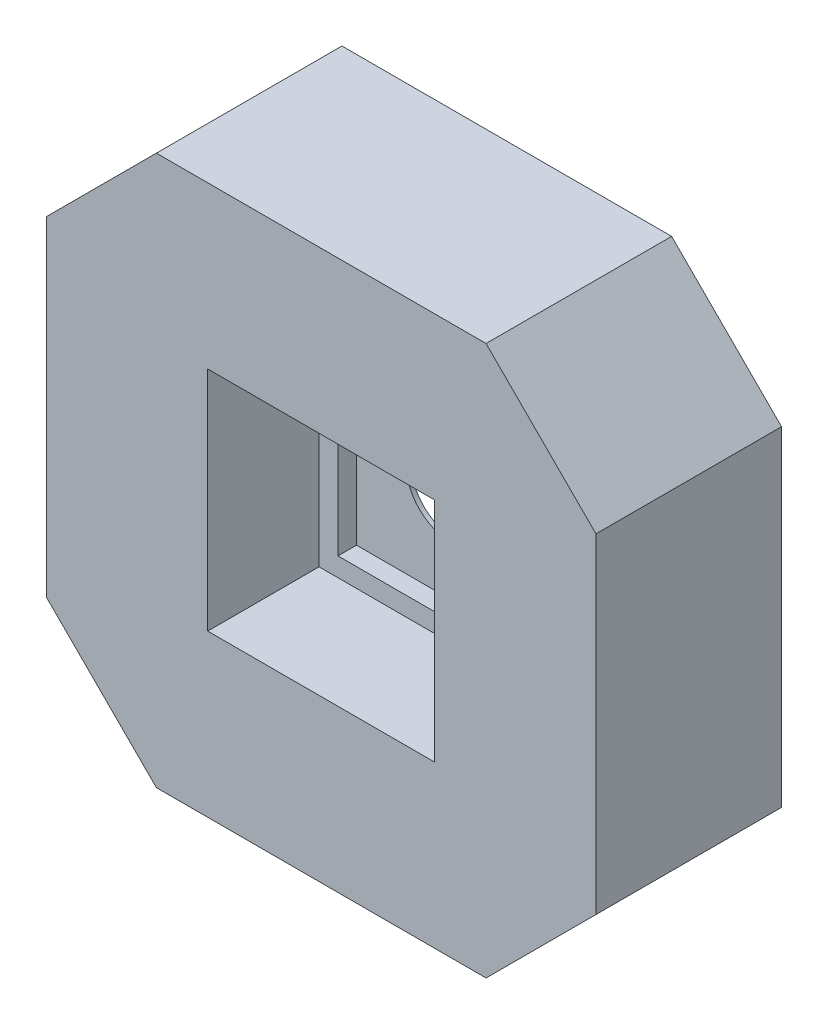
from build123d import *

# Parameters (mm, degrees)
EXTRUDE_1_DEPTH                    = 206
SKETCH_3_W                         = 252
SKETCH_3_H                         = 252
CUT_EXTRUDE_2_DEPTH                = 123.6
SKETCH_5_W                         = 210
SKETCH_5_H                         = 210
CUT_EXTRUDE_3_DEPTH                = 144.2
SHELL_1_T                          = -5
SKETCH_6_R                         = 50
CUT_EXTRUDE_4_DEPTH                = 455.80065963
RIB_1_REACH                        = 542.993
SKETCH_9_WALL_W                    = 1254.563441332
SKETCH_9_WALL_H                    = 10
PATTERN_CIRCULAR_2_COPY_1_REACH    = 542.993
PATTERN_CIRCULAR_2_COPY_1_SKETCH_W = 1254.563441332
PATTERN_CIRCULAR_2_COPY_1_SKETCH_H = 10
PATTERN_CIRCULAR_2_COPY_2_REACH    = 542.993
PATTERN_CIRCULAR_2_COPY_2_SKETCH_W = 1254.563441332
PATTERN_CIRCULAR_2_COPY_2_SKETCH_H = 10
PATTERN_CIRCULAR_2_COPY_3_REACH    = 542.993
PATTERN_CIRCULAR_2_COPY_3_SKETCH_W = 1254.563441332
PATTERN_CIRCULAR_2_COPY_3_SKETCH_H = 10
PATTERN_CIRCULAR_2_COPY_4_REACH    = 542.993
PATTERN_CIRCULAR_2_COPY_4_SKETCH_W = 1254.563441332
PATTERN_CIRCULAR_2_COPY_4_SKETCH_H = 10
PATTERN_CIRCULAR_2_COPY_5_REACH    = 542.993
PATTERN_CIRCULAR_2_COPY_5_SKETCH_W = 1254.563441332
PATTERN_CIRCULAR_2_COPY_5_SKETCH_H = 10
PATTERN_CIRCULAR_2_COPY_6_REACH    = 542.993
PATTERN_CIRCULAR_2_COPY_6_SKETCH_W = 1254.563441332
PATTERN_CIRCULAR_2_COPY_6_SKETCH_H = 10


with BuildPart() as part:
    # 草图2 → 凸台-拉伸1 (new body)
    with BuildSketch(Plane.XY):
        Polygon((-183, 305), (-305, 183), (-305, -183), (-183, -305), (183, -305), (305, -183), (305, 183), (183, 305), align=None)
    extrude(amount=EXTRUDE_1_DEPTH)

    # 草图3 → 切除-拉伸2 (cut)
    with BuildSketch(Plane.XY.offset(206)):
        Rectangle(SKETCH_3_W, SKETCH_3_H)
    extrude(amount=-CUT_EXTRUDE_2_DEPTH, mode=Mode.SUBTRACT)

    # 草图5 → 切除-拉伸3 (cut)
    with BuildSketch(Plane.XY.offset(206)):
        Rectangle(SKETCH_5_W, SKETCH_5_H)
    extrude(amount=-CUT_EXTRUDE_3_DEPTH, mode=Mode.SUBTRACT)

    # 抽壳1
    shell_1_openings = [part.faces().sort_by_distance(p)[0] for p in [
        (0, 0, 0),
    ]]
    offset(amount=SHELL_1_T, openings=shell_1_openings, kind=Kind.INTERSECTION)

    # 草图6 → 切除-拉伸4 (cut, through all)
    with BuildSketch(Plane.XY.offset(61.8)):
        Circle(SKETCH_6_R)
    extrude(amount=-CUT_EXTRUDE_4_DEPTH, mode=Mode.SUBTRACT)

    # 草图9 wall → 筋1 (add, up to next)
    with BuildSketch(Plane(origin=(215.502773099, 91.5, 97.210259174), x_dir=(0.984807753012, 0, 0.173648177669), z_dir=(0.173648177669, 0, -0.984807753012)), mode=Mode.PRIVATE) as rib_1_sk1:
        Rectangle(SKETCH_9_WALL_W, SKETCH_9_WALL_H)
    rib_1_tool1 = extrude(rib_1_sk1.sketch, amount=-RIB_1_REACH, mode=Mode.PRIVATE) - part.part
    rib_1 = rib_1_tool1.solids().sort_by_distance((215.502773099, 91.5, 97.210259174))[0]
    add(rib_1)

    # 镜向1: 筋1 across plane
    add(rib_1.mirror(Plane.ZX))

    # 阵列(圆周)2 copy 1 sketch → 阵列(圆周)2 copy 1 (add, up to next)
    with BuildSketch(Plane(origin=(91.5, 215.502773099, 97.210259174), x_dir=(0, 0.984807753012, 0.173648177669), z_dir=(0, 0.173648177669, -0.984807753012)), mode=Mode.PRIVATE) as pattern_circular_2_copy_1_sk1:
        Rectangle(PATTERN_CIRCULAR_2_COPY_1_SKETCH_W, PATTERN_CIRCULAR_2_COPY_1_SKETCH_H)
    pattern_circular_2_copy_1_tool1 = extrude(pattern_circular_2_copy_1_sk1.sketch, amount=-PATTERN_CIRCULAR_2_COPY_1_REACH, mode=Mode.PRIVATE) - part.part
    add(pattern_circular_2_copy_1_tool1.solids().sort_by_distance((91.5, 215.502773099, 97.210259174))[0])

    # 阵列(圆周)2 copy 2 sketch → 阵列(圆周)2 copy 2 (add, up to next)
    with BuildSketch(Plane(origin=(-215.502773099, 91.5, 97.210259174), x_dir=(-0.984807753012, 0, 0.173648177669), z_dir=(-0.173648177669, 0, -0.984807753012)), mode=Mode.PRIVATE) as pattern_circular_2_copy_2_sk1:
        Rectangle(PATTERN_CIRCULAR_2_COPY_2_SKETCH_W, PATTERN_CIRCULAR_2_COPY_2_SKETCH_H)
    pattern_circular_2_copy_2_tool1 = extrude(pattern_circular_2_copy_2_sk1.sketch, amount=-PATTERN_CIRCULAR_2_COPY_2_REACH, mode=Mode.PRIVATE) - part.part
    add(pattern_circular_2_copy_2_tool1.solids().sort_by_distance((-215.502773099, 91.5, 97.210259174))[0])

    # 阵列(圆周)2 copy 3 sketch → 阵列(圆周)2 copy 3 (add, up to next)
    with BuildSketch(Plane(origin=(-91.5, -215.502773099, 97.210259174), x_dir=(0, -0.984807753012, 0.173648177669), z_dir=(0, -0.173648177669, -0.984807753012)), mode=Mode.PRIVATE) as pattern_circular_2_copy_3_sk1:
        Rectangle(PATTERN_CIRCULAR_2_COPY_3_SKETCH_W, PATTERN_CIRCULAR_2_COPY_3_SKETCH_H)
    pattern_circular_2_copy_3_tool1 = extrude(pattern_circular_2_copy_3_sk1.sketch, amount=-PATTERN_CIRCULAR_2_COPY_3_REACH, mode=Mode.PRIVATE) - part.part
    add(pattern_circular_2_copy_3_tool1.solids().sort_by_distance((-91.5, -215.502773099, 97.210259174))[0])

    # 阵列(圆周)2 copy 4 sketch → 阵列(圆周)2 copy 4 (add, up to next)
    with BuildSketch(Plane(origin=(-91.5, 215.502773099, 97.210259174), x_dir=(0, 0.984807753012, 0.173648177669), z_dir=(0, 0.173648177669, -0.984807753012)), mode=Mode.PRIVATE) as pattern_circular_2_copy_4_sk1:
        Rectangle(PATTERN_CIRCULAR_2_COPY_4_SKETCH_W, PATTERN_CIRCULAR_2_COPY_4_SKETCH_H)
    pattern_circular_2_copy_4_tool1 = extrude(pattern_circular_2_copy_4_sk1.sketch, amount=-PATTERN_CIRCULAR_2_COPY_4_REACH, mode=Mode.PRIVATE) - part.part
    add(pattern_circular_2_copy_4_tool1.solids().sort_by_distance((-91.5, 215.502773099, 97.210259174))[0])

    # 阵列(圆周)2 copy 5 sketch → 阵列(圆周)2 copy 5 (add, up to next)
    with BuildSketch(Plane(origin=(-215.502773099, -91.5, 97.210259174), x_dir=(-0.984807753012, 0, 0.173648177669), z_dir=(-0.173648177669, 0, -0.984807753012)), mode=Mode.PRIVATE) as pattern_circular_2_copy_5_sk1:
        Rectangle(PATTERN_CIRCULAR_2_COPY_5_SKETCH_W, PATTERN_CIRCULAR_2_COPY_5_SKETCH_H)
    pattern_circular_2_copy_5_tool1 = extrude(pattern_circular_2_copy_5_sk1.sketch, amount=-PATTERN_CIRCULAR_2_COPY_5_REACH, mode=Mode.PRIVATE) - part.part
    add(pattern_circular_2_copy_5_tool1.solids().sort_by_distance((-215.502773099, -91.5, 97.210259174))[0])

    # 阵列(圆周)2 copy 6 sketch → 阵列(圆周)2 copy 6 (add, up to next)
    with BuildSketch(Plane(origin=(91.5, -215.502773099, 97.210259174), x_dir=(0, -0.984807753012, 0.173648177669), z_dir=(0, -0.173648177669, -0.984807753012)), mode=Mode.PRIVATE) as pattern_circular_2_copy_6_sk1:
        Rectangle(PATTERN_CIRCULAR_2_COPY_6_SKETCH_W, PATTERN_CIRCULAR_2_COPY_6_SKETCH_H)
    pattern_circular_2_copy_6_tool1 = extrude(pattern_circular_2_copy_6_sk1.sketch, amount=-PATTERN_CIRCULAR_2_COPY_6_REACH, mode=Mode.PRIVATE) - part.part
    add(pattern_circular_2_copy_6_tool1.solids().sort_by_distance((91.5, -215.502773099, 97.210259174))[0])


solid = part.part
